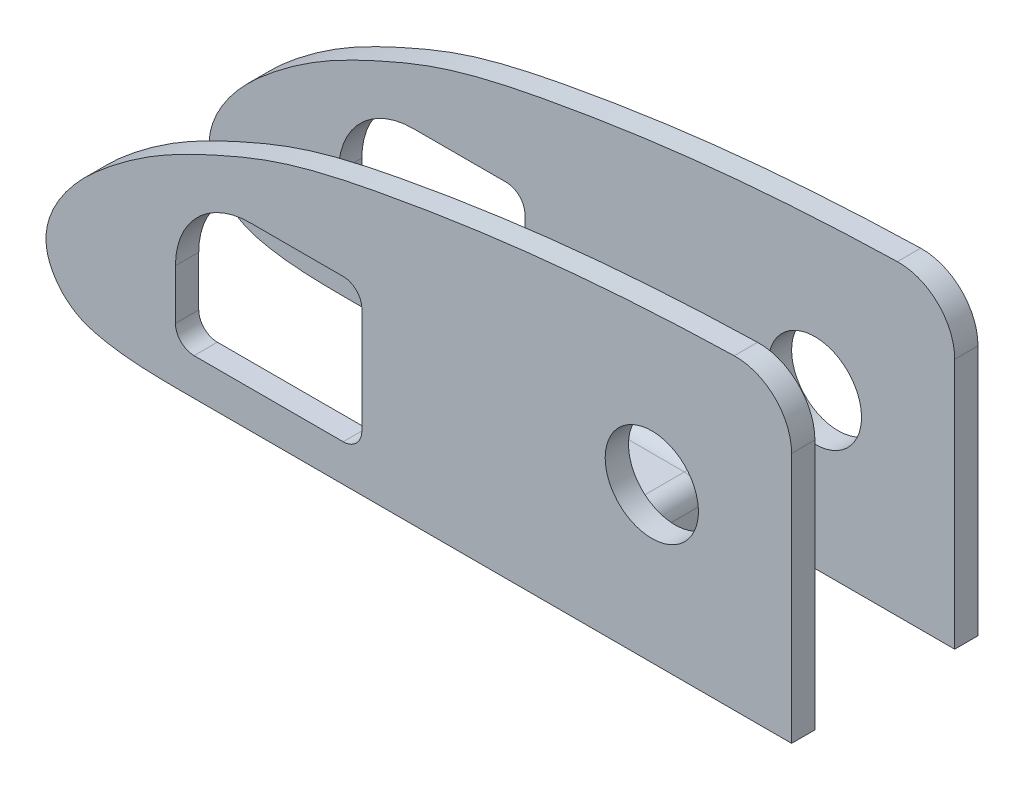
from build123d import *

# Parameters (mm, degrees)
BOSS_EXTRUDE1_DEPTH      = 12.7
BOSS_EXTRUDE1_DEPTH_BACK = 12.7
SKETCH2_W                = 19.05
SKETCH2_H                = 49.651656102
CUT_EXTRUDE1_DEPTH       = 310.423757716
SKETCH3_W                = 38.1
SKETCH3_H                = 5.044027725
SKETCH3_W_2              = 19.05
BOSS_EXTRUDE2_DEPTH      = 19.05
CUT_EXTRUDE3_DEPTH       = 50.8
CUT_EXTRUDE3_DEPTH_BACK  = 50.8
SKETCH12_R               = 6.35
SKETCH12_R_2             = 3.175
SKETCH12_R_3             = 5
FILLET8_R                = 2.54
SKETCH13_W               = 213.045597148
SKETCH13_H               = 55.670329679
CUT_EXTRUDE4_DEPTH       = 311.204708703
FILLET9_START            = 9
FILLET9_DEPTH            = 5
FILLET10_START           = -14
FILLET10_DEPTH           = 5
CUT_EXTRUDE5_DEPTH       = 113.114633783
CUT_EXTRUDE5_DEPTH_BACK  = 113.114633783
FILLET11_R               = 2.54
SKETCH8_R                = 3.175
CUT_EXTRUDE2_DEPTH       = 109.799942755


with BuildPart() as part:
    # Sketch1 → Boss-Extrude1 (new, two sides: drawn at the far end of the back side and taken through both)
    with BuildSketch(Plane.XY.offset(-BOSS_EXTRUDE1_DEPTH_BACK)):
        with BuildLine():
            Line((306.2918866, 1.929193729), (306.2918866, 0.035972275))
            Line((306.2918866, 0.035972275), (18.385743088, 0.035972275))
            add(Edge.make_bspline(
                [(306.2918866, 1.929193729), (306.565703117, 2.60439044), (288.5800577, 7.542224382), (271.922557924, 13.119693618), (244.545512993, 21.039717296), (214.63705438, 29.578808281), (183.74892315, 35.843363942), (153.039666672, 39.584058053), (122.364389131, 41.910380286), (91.676834287, 42.234137684), (66.092232531, 40.375185886), (45.725322729, 37.15263137), (32.792424184, 34.392213233), (22.784634494, 30.143895353), (14.954380304, 26.333975955), (8.569620221, 21.769960087), (2.606076707, 16.225698301), (-1.858362456, 8.564778309), (3.017819974, 2.013571533), (8.993020993, 0.344786487), (13.886881629, 0.072440703), (17.418928388, 0.035163036), (18.385743088, 0.035972275)],
                knots=[0, 0, 0, 0, 0.025556044, 0.050960447, 0.101552747, 0.151805438, 0.201252492, 0.250083002, 0.298629141, 0.347026117, 0.395536064, 0.420002519, 0.444885368, 0.457915187, 0.471441031, 0.48620838, 0.494593531, 0.510948222, 0.521394631, 0.527823606, 0.539981828, 0.544566103, 0.544566103, 0.544566103, 0.544566103], degree=3))
        make_face()
    extrude(amount=BOSS_EXTRUDE1_DEPTH + BOSS_EXTRUDE1_DEPTH_BACK)

    # Sketch2 → Cut-Extrude1 (cut, through all)
    with BuildSketch(Plane(origin=(0, 0, 0), x_dir=(0, 0, -1), z_dir=(1, 0, 0))):
        with Locations((0, 22.711736939)):
            Rectangle(SKETCH2_W, SKETCH2_H)
    extrude(amount=CUT_EXTRUDE1_DEPTH, mode=Mode.SUBTRACT)


with BuildPart() as cut_extrude1_piece_1:
    # of the separate pieces the step leaves, piece 1, a body of its own (cut_extrude1_pieces)
    add(part.part.solids().sort_by_distance((306.2918866, 0.035972275, 9.525))[0])



with BuildPart() as cut_extrude1_piece_2:
    # of the separate pieces the step leaves, piece 2, a body of its own (cut_extrude1_pieces)
    add(part.part.solids().sort_by_distance((306.2918866, 1.929193729, -9.525))[0])


with BuildPart() as cut_extrude1_piece_1_1:
    add(cut_extrude1_piece_1.part)

    add(cut_extrude1_piece_2.part)  # Boss-Extrude2 merges Cut-Extrude1 piece 2
    # Sketch3 → Boss-Extrude2 (add)
    with BuildSketch(Plane.XY.offset(-9.525)):
        with Locations((190.372920526, 2.557986137)):
            Rectangle(SKETCH3_W, SKETCH3_H)
        with Locations((60.325, 2.557986137)):
            Rectangle(SKETCH3_W_2, SKETCH3_H)
    extrude(amount=BOSS_EXTRUDE2_DEPTH)

    # Sketch12 → Cut-Extrude3 (cut, two sides: drawn at the far end of the back side and taken through both)
    with BuildSketch(Plane.XY.offset(-CUT_EXTRUDE3_DEPTH_BACK)):
        with Locations(Location((82.55, 21.048356458, 0), (0, 0, 180))):
            Circle(SKETCH12_R)
        with Locations(Location((152.4, 21.048356458, 0), (0, 0, 180))):
            Circle(SKETCH12_R_2)
        with Locations(Location((228.6, 13.349794258, 0), (0, 0, 180))):
            Circle(SKETCH12_R_2)
        with Locations(Location((117.475, 21.048356458, 0), (0, 0, 180))):
            Circle(SKETCH12_R_3)
    extrude(amount=CUT_EXTRUDE3_DEPTH + CUT_EXTRUDE3_DEPTH_BACK, mode=Mode.SUBTRACT)

    # Fillet8
    fillet8_edges = [cut_extrude1_piece_1_1.edges().sort_by_distance(p)[0] for p in [
        (60.325, 5.08, -9.525),
        (69.85, 2.557986137, -9.525),
        (60.325, 5.08, 9.525),
        (69.85, 2.557986137, 9.525),
        (171.322920526, 2.557986137, -9.525),
        (171.322920526, 5.08, 0),
        (190.372920526, 5.08, 9.525),
        (209.422920526, 5.08, 0),
        (190.372920526, 5.08, -9.525),
        (209.422920526, 2.557986137, 9.525),
        (209.422920526, 2.557986137, -9.525),
        (171.322920526, 2.557986137, 9.525),
        (69.85, 5.08, 0),
        (50.8, 2.557986137, 9.525),
        (50.8, 5.08, 0),
        (50.8, 2.557986137, -9.525),
    ]]
    fillet(fillet8_edges, radius=FILLET8_R)

    # Sketch13 → Cut-Extrude4 (cut, through all)
    with BuildSketch(Plane.XY.offset(12.7)):
        with Locations((208.122798574, 27.871137115)):
            Rectangle(SKETCH13_W, SKETCH13_H)
    extrude(amount=-CUT_EXTRUDE4_DEPTH, mode=Mode.SUBTRACT)

    # Fillet9: read off the stored shape, not the designer's step
    # Fillet9 outline → Fillet9 (cut)
    with BuildSketch(Plane.XY.offset(FILLET9_START)):
        with BuildLine():
            ThreePointArc((93.786667063, 41.868544727), (99.299361006, 39.707076762), (101.6, 34.250997722))
            Line((101.6, 34.250997722), (101.6, 41.986781628))
            add(Edge.make_bspline(
                [(101.6, 41.986781628), (98.995537309, 41.973544215), (96.390994688, 41.934642423), (93.786667063, 41.868544727)],
                knots=[0.331387316, 0.331387316, 0.331387316, 0.331387316, 0.343736136, 0.343736136, 0.343736136, 0.343736136], degree=3))
        make_face()
    extrude(amount=FILLET9_DEPTH, mode=Mode.SUBTRACT)

    # Fillet10: read off the stored shape, not the designer's step
    # Fillet10 outline → Fillet10 (cut)
    with BuildSketch(Plane.XY.offset(FILLET10_START)):
        with BuildLine():
            ThreePointArc((93.786667063, 41.868544727), (99.299361006, 39.707076762), (101.6, 34.250997722))
            Line((101.6, 34.250997722), (101.6, 41.986781628))
            add(Edge.make_bspline(
                [(101.6, 41.986781628), (98.995537309, 41.973544215), (96.390994688, 41.934642423), (93.786667063, 41.868544727)],
                knots=[0.331387316, 0.331387316, 0.331387316, 0.331387316, 0.343736136, 0.343736136, 0.343736136, 0.343736136], degree=3))
        make_face()
    extrude(amount=FILLET10_DEPTH, mode=Mode.SUBTRACT)

    # Sketch3<7> → Cut-Extrude5 (cut, two sides: drawn at the far end of the back side and taken through both)
    with BuildSketch(Plane.XY.offset(-9.525).offset(-CUT_EXTRUDE5_DEPTH_BACK)):
        with BuildLine():
            ThreePointArc((17.639162626, 14.426247308), (20.614957729, 21.610452205), (27.799162626, 24.586247308))
            Line((27.799162626, 24.586247308), (43.039162626, 24.586247308))
            Line((43.039162626, 24.586247308), (43.039162626, 5.08))
            Line((43.039162626, 5.08), (17.639162626, 5.08))
            Line((17.639162626, 5.08), (17.639162626, 14.426247308))
        make_face()
    extrude(amount=CUT_EXTRUDE5_DEPTH + CUT_EXTRUDE5_DEPTH_BACK, mode=Mode.SUBTRACT)

    # Fillet11
    fillet11_edges = [cut_extrude1_piece_1_1.edges().sort_by_distance(p)[0] for p in [
        (43.039162626, 24.586247308, -11.1125),
        (43.039162626, 5.08, -11.1125),
        (17.639162626, 5.08, -11.1125),
        (43.039162626, 24.586247308, 11.1125),
        (43.039162626, 5.08, 11.1125),
        (17.639162626, 5.08, 11.1125),
    ]]
    fillet(fillet11_edges, radius=FILLET11_R)

    # Sketch8 → Cut-Extrude2 (cut, through all)
    with BuildSketch(Plane(origin=(0, 5.08, 0), x_dir=(-1, 0, 0), z_dir=(0, 1, 0))):
        with Locations((-60.325, 0)):
            Circle(SKETCH8_R)
    extrude(amount=-CUT_EXTRUDE2_DEPTH, mode=Mode.SUBTRACT)


solid = cut_extrude1_piece_1_1.part
